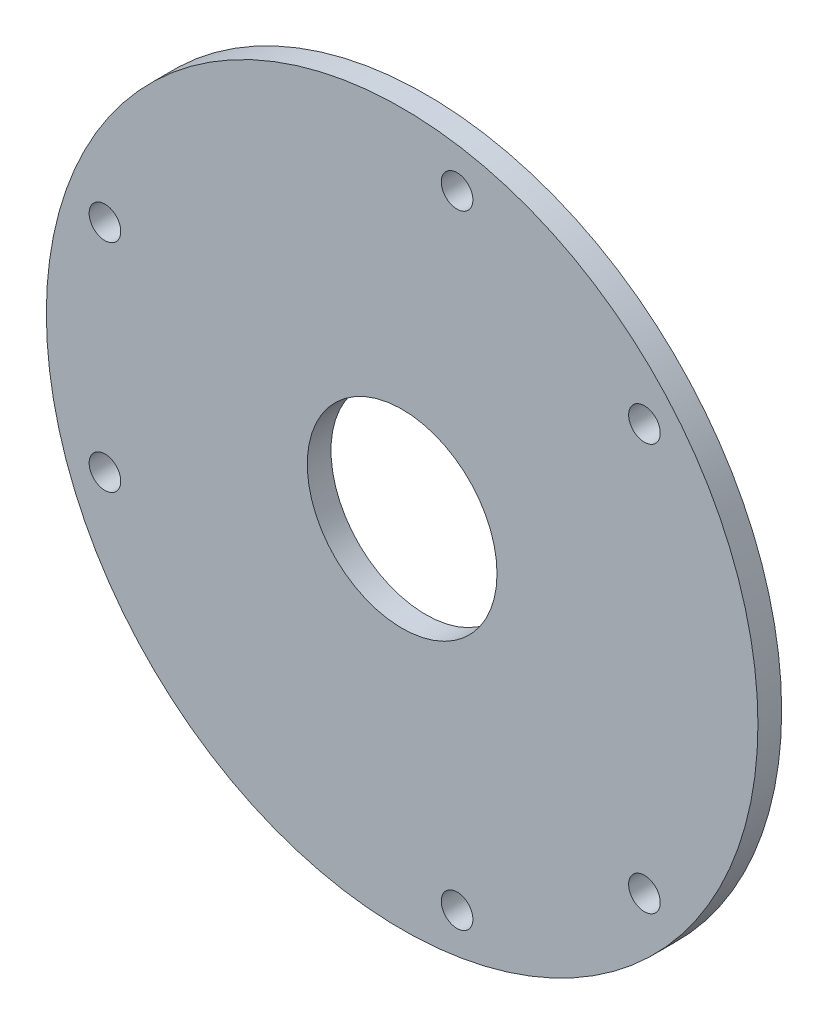
from build123d import *

# Parameters (mm, degrees)
SKETCH1_R           = 45
SKETCH1_R_2         = 2
SKETCH1_R_3         = 12
BOSS_EXTRUDE1_DEPTH = 3


with BuildPart() as part:
    # Sketch1 → Boss-Extrude1 (new body)
    with BuildSketch(Plane.XY):
        Circle(SKETCH1_R)
        with Locations((-37.587704831, 13.680805733)):
            Circle(SKETCH1_R_2, mode=Mode.SUBTRACT)
        with Locations((6.945927107, 39.39231012)):
            Circle(SKETCH1_R_2, mode=Mode.SUBTRACT)
        with Locations((30.641777725, 25.711504387)):
            Circle(SKETCH1_R_2, mode=Mode.SUBTRACT)
        with Locations((-37.587704831, -13.680805733)):
            Circle(SKETCH1_R_2, mode=Mode.SUBTRACT)
        with Locations((6.945927107, -39.39231012)):
            Circle(SKETCH1_R_2, mode=Mode.SUBTRACT)
        with Locations((30.641777725, -25.711504387)):
            Circle(SKETCH1_R_2, mode=Mode.SUBTRACT)
        Circle(SKETCH1_R_3, mode=Mode.SUBTRACT)
    extrude(amount=BOSS_EXTRUDE1_DEPTH)


solid = part.part
